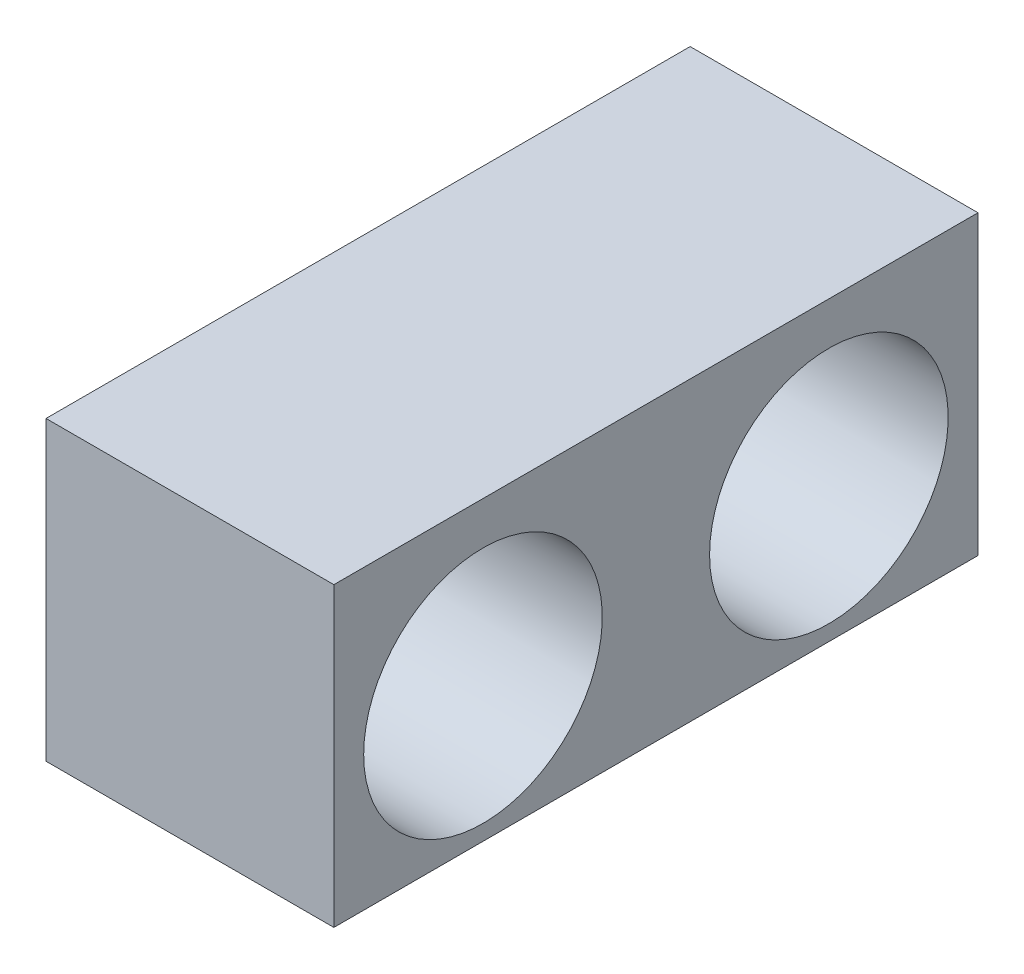
from build123d import *

# Parameters (mm, degrees)
SKETCH1_R           = 75
BOSS_EXTRUDE1_DEPTH = 100
SKETCH2_OUTSIDE_W   = 198.904
SKETCH2_OUTSIDE_H   = 198.904
SKETCH2_OUTSIDE_W_2 = 44.4
SKETCH2_OUTSIDE_H_2 = 99.351371604
CUT_EXTRUDE1_DEPTH  = 146.773797371
SKETCH3_W           = 44.4
SKETCH3_H           = 54.209155611
CUT_EXTRUDE2_DEPTH  = 143.70085858
SKETCH4_R           = 18.4
CUT_EXTRUDE3_DEPTH  = 81.844512428


with BuildPart() as part:
    # Sketch1 → Boss-Extrude1 (new body)
    with BuildSketch(Plane(origin=(0, 0, 0), x_dir=(1, 0, 0), z_dir=(0, 1, 0))):
        Circle(SKETCH1_R)
    extrude(amount=BOSS_EXTRUDE1_DEPTH)

    # Sketch2 outside → Cut-Extrude1 (cut, through all)
    with BuildSketch(Plane(origin=(0, 100, 0), x_dir=(1, 0, 0), z_dir=(0, 1, 0))):
        Rectangle(SKETCH2_OUTSIDE_W, SKETCH2_OUTSIDE_H)
        Rectangle(SKETCH2_OUTSIDE_W_2, SKETCH2_OUTSIDE_H_2, mode=Mode.SUBTRACT)
    extrude(amount=-CUT_EXTRUDE1_DEPTH, mode=Mode.SUBTRACT)

    # Sketch3 → Cut-Extrude2 (cut, through all)
    with BuildSketch(Plane.XY.offset(49.675685802)):
        with Locations((0, 72.895422195)):
            Rectangle(SKETCH3_W, SKETCH3_H)
    extrude(amount=-CUT_EXTRUDE2_DEPTH, mode=Mode.SUBTRACT)

    # Sketch4 → Cut-Extrude3 (cut, through all)
    with BuildSketch(Plane.ZY.offset(22.2)):
        with Locations((26.675685802, 20.790844389)):
            Circle(SKETCH4_R)
        with Locations((-26.675685802, 20.790844389)):
            Circle(SKETCH4_R)
    extrude(amount=-CUT_EXTRUDE3_DEPTH, mode=Mode.SUBTRACT)


solid = part.part
